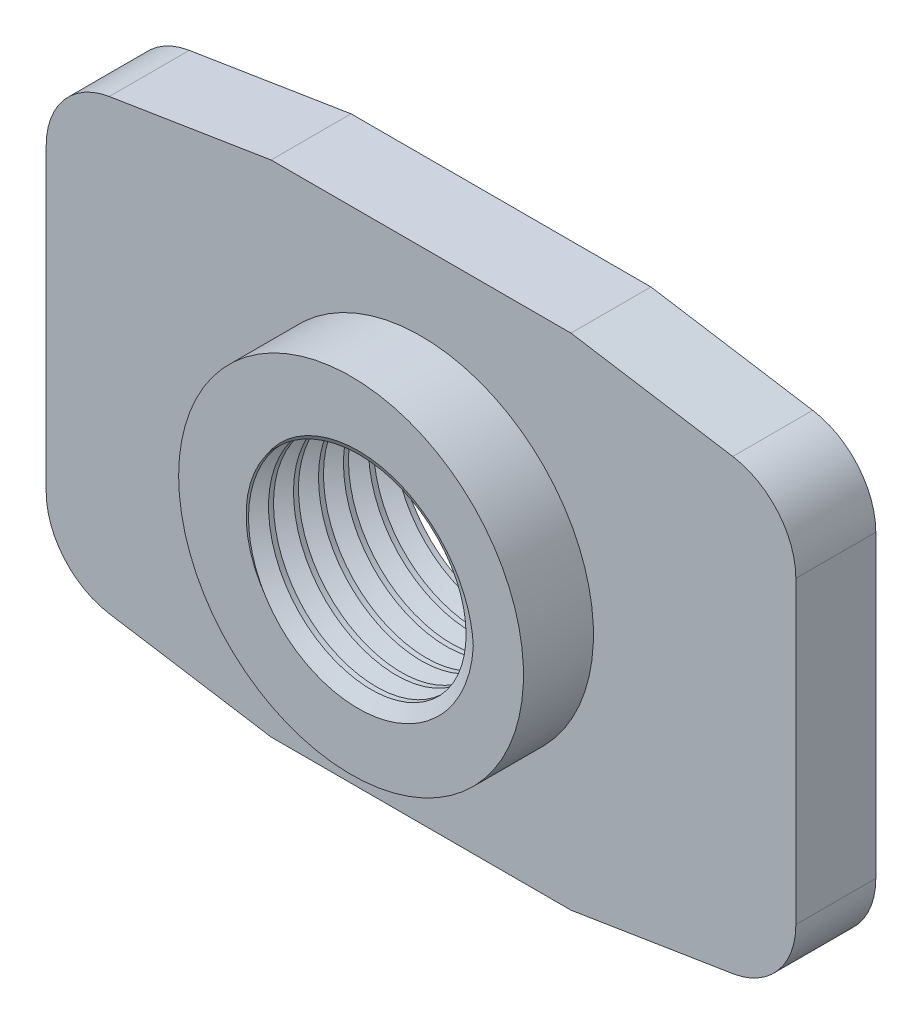
from build123d import *

# Parameters (mm, degrees)
BOSS_EXTRUDE1_DEPTH        = 1.6
DRAFT1_ANGLE               = 9.10617604
SKETCH2_W                  = 3.45
SKETCH2_H                  = 1.4
F_4_2_4_2_DIAMETER_HOLE1_D = 4.2
FILLET1_R                  = 1.5
CUT_SWEEP1_PITCH           = 0.5


with BuildPart() as part:
    # Sketch1 → Boss-Extrude1 (new body)
    with BuildSketch(Plane.XY.offset(1.6)):
        Polygon((3, -5), (6.092206474, -4.504366896), (7.5, 4.278719262), (3, 5), (-3, 5), (-7.5, 4.278719262), (-7.5, -4.278719262), (-3, -5), align=None)
    extrude(amount=-BOSS_EXTRUDE1_DEPTH)

    # Draft1
    draft1_faces = [part.faces().sort_by_distance(p)[0] for p in [
        (6.796103237, -0.112823817, 0.8),
    ]]
    draft(draft1_faces, Plane(origin=(7.5, 4.278719262, 0), x_dir=(0.9873967528040769, -0.15826450186938548, 0), z_dir=(0.15826450186938548, 0.9873967528040769, 0)), DRAFT1_ANGLE)

    # Sketch2 → Revolve1 (revolve)
    with BuildSketch(Plane.XZ, mode=Mode.PRIVATE) as revolve1_sk:
        with Locations((1.725, 2.3)):
            Rectangle(SKETCH2_W, SKETCH2_H)
    revolve(revolve1_sk.sketch.rotate(Axis((0, 0, 3), (0, 0, -1)), 180), axis=Axis((0, 0, 3), (0, 0, -1)))

    # Ø4.2 (4.2) Diameter Hole1 (through all)
    with Locations(Plane.XY.offset(3)):
        with Locations((0, 0)):
            Hole(F_4_2_4_2_DIAMETER_HOLE1_D / 2)

    # Fillet1
    fillet1_edges = [part.edges().sort_by_distance(p)[0] for p in [
        (-7.5, -4.278719262, 0.8),
        (-7.5, 4.278719262, 0.8),
        (7.5, 4.278719262, 0.8),
        (7.5, -4.278719262, 0.8),
    ]]
    fillet(fillet1_edges, radius=FILLET1_R)

    # Cut-Sweep1: arcs per turn and ends read off the stored shape
    # Cut-Sweep1: the profile of Sketch6 screwed along a right-hand helix through 8 turns, 6 arcs to a turn; built about Z, then put on its axis
    cut_sweep1_z = Axis((0, 0, 0), (0, 0, 1))
    cut_sweep1_corners = [(-1.223205081, -2.118653348, -0.666666667), (-0.96339746, -1.668653348, -0.366666667), (-0.96339746, -1.668653348, -0.966666667)]
    with BuildLine(mode=Mode.PRIVATE) as cut_sweep1_profile:
        Line(cut_sweep1_corners[0], cut_sweep1_corners[1])
        Line(cut_sweep1_corners[1], cut_sweep1_corners[2])
        Line(cut_sweep1_corners[2], cut_sweep1_corners[0])
    cut_sweep1_cap = Face(cut_sweep1_profile.wire())
    cut_sweep1_turn_angles = [0, 30, 60, 90, 120, 150, 180, 210, 240, 270, 300, 330, 360]
    cut_sweep1_turn_weights = [1, 0.8660254037844387, 1, 0.8660254037844387, 1, 0.8660254037844387, 1, 0.8660254037844387, 1, 0.8660254037844387, 1, 0.8660254037844387, 1]
    cut_sweep1_turn_rails = [Edge.make_bspline([Vector(p[0], p[1], 0).rotate(cut_sweep1_z, cut_sweep1_turn_angles[k]) / cut_sweep1_turn_weights[k] + Vector(0, 0, p[2] + CUT_SWEEP1_PITCH * cut_sweep1_turn_angles[k] / 360) for k in range(13)], [0, 0, 0, 1, 1, 2, 2, 3, 3, 4, 4, 5, 5, 6, 6, 6], 2, cut_sweep1_turn_weights) for p in cut_sweep1_corners]
    cut_sweep1_turn_sides = [Face.make_surface_from_curves(cut_sweep1_turn_rails[p[0]], cut_sweep1_turn_rails[p[1]]) for p in [(0, 1), (1, 2), (2, 0)]]
    cut_sweep1 = Plane(origin=(0, 0, 3), x_dir=(1, 0, 0), z_dir=(0, 0, -1)) * Solid(Shell([*[p.moved(Location((0, 0, CUT_SWEEP1_PITCH * i))) for i in range(8) for p in cut_sweep1_turn_sides], cut_sweep1_cap, cut_sweep1_cap.rotate(cut_sweep1_z, 2880).moved(Location((0, 0, CUT_SWEEP1_PITCH * 2880 / 360)))]))
    add(cut_sweep1, mode=Mode.SUBTRACT)


solid = part.part
